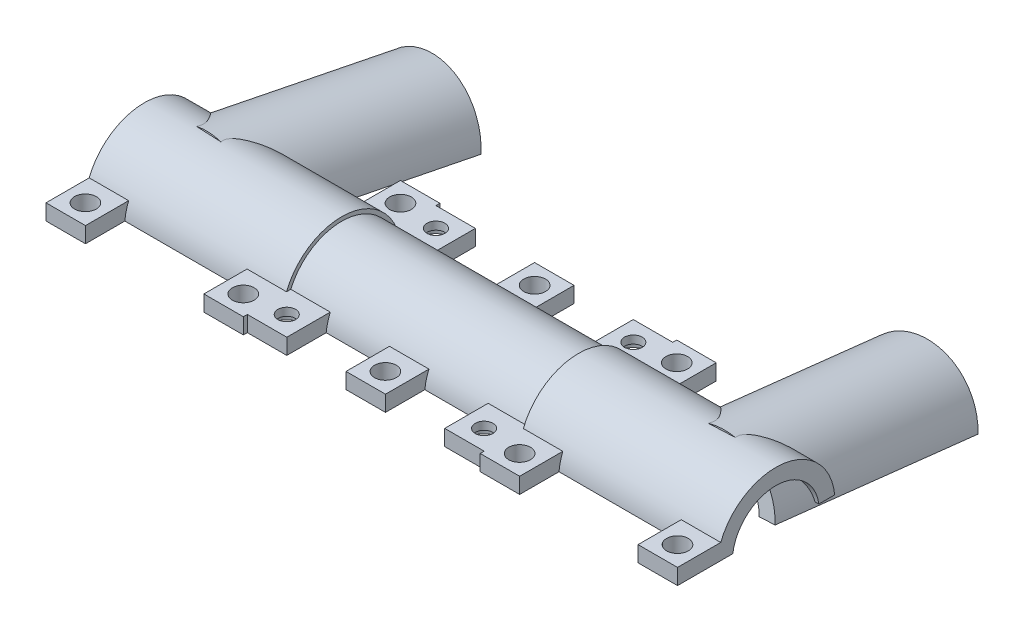
from build123d import *

# Parameters (mm, degrees)
BOSS_EXTRUDE2_DEPTH = 30
SKETCH2_W           = 10
SKETCH2_H           = 14
SKETCH2_R           = 2.25
SKETCH2_R_2         = 2.75
BOSS_EXTRUDE3_DEPTH = 4
SKETCH6_R           = 4
CUT_EXTRUDE1_DEPTH  = 2
BOSS_EXTRUDE4_DEPTH = 50
SKETCH8_W           = 10
SKETCH8_H           = 14
SKETCH8_R           = 2.75
BOSS_EXTRUDE5_DEPTH = 4
BOSS_EXTRUDE6_DEPTH = 55


with BuildPart() as part:
    # Sketch1 → Boss-Extrude2 (new, symmetric)
    with BuildSketch(Plane(origin=(0, 0, 0), x_dir=(0, 0, -1), z_dir=(1, 0, 0))):
        with BuildLine():
            Line((-13.919410907, 1.5), (-9.886859967, 1.5))
            ThreePointArc((-9.886859967, 1.5), (0, 10), (9.886859967, 1.5))
            Line((9.886859967, 1.5), (13.919410907, 1.5))
            ThreePointArc((13.919410907, 1.5), (0, 14), (-13.919410907, 1.5))
        make_face()
    extrude(amount=BOSS_EXTRUDE2_DEPTH, both=True)

    # Sketch2 → Boss-Extrude3 (add)
    # profile 1 of 6: a face of its own
    with BuildSketch(Plane.XZ.offset(-1.5)):
        with Locations((-25, -16.886859967)):
            Rectangle(SKETCH2_W, SKETCH2_H)
        with Locations((-25, -18.903135437)):
            Circle(SKETCH2_R, mode=Mode.SUBTRACT)
    # profile 2 of 6: a face of its own
    with BuildSketch(Plane.XZ.offset(-1.5)):
        with Locations((25, -16.886859967)):
            Rectangle(SKETCH2_W, SKETCH2_H)
        with Locations((25, -18.903135437)):
            Circle(SKETCH2_R, mode=Mode.SUBTRACT)
    # profile 3 of 6: a face of its own
    with BuildSketch(Plane.XZ.offset(-1.5)):
        with Locations((-25, 16.886859967)):
            Rectangle(SKETCH2_W, SKETCH2_H)
        with Locations((-25, 18.903135437)):
            Circle(SKETCH2_R, mode=Mode.SUBTRACT)
    # profile 4 of 6: a face of its own
    with BuildSketch(Plane.XZ.offset(-1.5)):
        with Locations((25, 16.886859967)):
            Rectangle(SKETCH2_W, SKETCH2_H)
        with Locations((25, 18.903135437)):
            Circle(SKETCH2_R, mode=Mode.SUBTRACT)
    # profile 5 of 6: a face of its own
    with BuildSketch(Plane.XZ.offset(-1.5)):
        with Locations((0, 16.886859967)):
            Rectangle(SKETCH2_W, SKETCH2_H)
        with Locations((0, 18.903135437)):
            Circle(SKETCH2_R_2, mode=Mode.SUBTRACT)
    # profile 6 of 6: a face of its own
    with BuildSketch(Plane.XZ.offset(-1.5)):
        with Locations((0, -16.886859967)):
            Rectangle(SKETCH2_W, SKETCH2_H)
        with Locations((0, -18.903135437)):
            Circle(SKETCH2_R_2, mode=Mode.SUBTRACT)
    extrude(amount=-BOSS_EXTRUDE3_DEPTH)

    # Sketch6 → Cut-Extrude1 (cut)
    with BuildSketch(Plane.XZ.offset(-1.5)):
        with Locations((-25, 18.903135437)):
            Circle(SKETCH6_R)
        with Locations((25, -18.903135437)):
            Circle(SKETCH6_R)
        with Locations((-25, -18.903135437)):
            Circle(SKETCH6_R)
        with Locations((25, 18.903135437)):
            Circle(SKETCH6_R)
    extrude(amount=-CUT_EXTRUDE1_DEPTH, mode=Mode.SUBTRACT)

    # Sketch7 → Boss-Extrude4 (add)
    with BuildSketch(Plane.ZY.offset(30)):
        with BuildLine():
            Line((-14.924811557, 1.5), (-10.897247359, 1.5))
            ThreePointArc((-10.897247359, 1.5), (0, 11), (10.897247359, 1.5))
            Line((10.897247359, 1.5), (14.924811557, 1.5))
            ThreePointArc((14.924811557, 1.5), (0, 15), (-14.924811557, 1.5))
        make_face()
    boss_extrude4 = extrude(amount=BOSS_EXTRUDE4_DEPTH)

    # Sketch8 → Boss-Extrude5 (add)
    # profile 1 of 3: a face of its own
    with BuildSketch(Plane.XZ.offset(-1.5)):
        with Locations((-75, 17.897247359)):
            Rectangle(SKETCH8_W, SKETCH8_H)
        with Locations((-75, 19.911029458)):
            Circle(SKETCH8_R, mode=Mode.SUBTRACT)
    # profile 2 of 3: a face of its own
    with BuildSketch(Plane.XZ.offset(-1.5)):
        with Locations((-35, 17.897247359)):
            Rectangle(SKETCH8_W, SKETCH8_H)
        with Locations((-35, 19.911029458)):
            Circle(SKETCH8_R, mode=Mode.SUBTRACT)
    # profile 3 of 3: a face of its own
    with BuildSketch(Plane.XZ.offset(-1.5)):
        with Locations((-35, -17.897247359)):
            Rectangle(SKETCH8_W, SKETCH8_H)
        with Locations((-35, -19.911029458)):
            Circle(SKETCH8_R, mode=Mode.SUBTRACT)
    boss_extrude5 = extrude(amount=-BOSS_EXTRUDE5_DEPTH)

    # Mirror1: Boss-Extrude4, Boss-Extrude5 across plane
    add(boss_extrude4.mirror(Plane(origin=(0, 0, 0), x_dir=(0, 0, 1), z_dir=(1, 0, 0))))
    add(boss_extrude5.mirror(Plane(origin=(0, 0, 0), x_dir=(0, 0, 1), z_dir=(1, 0, 0))))

    # Sketch13 → Boss-Extrude6 (add)
    with BuildSketch(Plane(origin=(-62.205163787, -7.919222016, -53.328651794), x_dir=(-0.998626090762714, 0.0004053344194906099, -0.05240006251893585), z_dir=(0.05169161377505367, -0.15643446504023129, -0.9863347480510395))):
        with BuildLine():
            Line((10.897247359, 1.5), (14.723790273, 1.5))
            ThreePointArc((14.723790273, 1.5), (0, 14.8), (-14.723790273, 1.5))
            Line((-14.723790273, 1.5), (-10.897247359, 1.5))
            ThreePointArc((-10.897247359, 1.5), (0, 11), (10.897247359, 1.5))
        make_face()
    boss_extrude6 = extrude(amount=-BOSS_EXTRUDE6_DEPTH)

    # Mirror2: Boss-Extrude6 across plane
    add(boss_extrude6.mirror(Plane(origin=(0, 0, 0), x_dir=(0, 0, 1), z_dir=(1, 0, 0))))


solid = part.part
